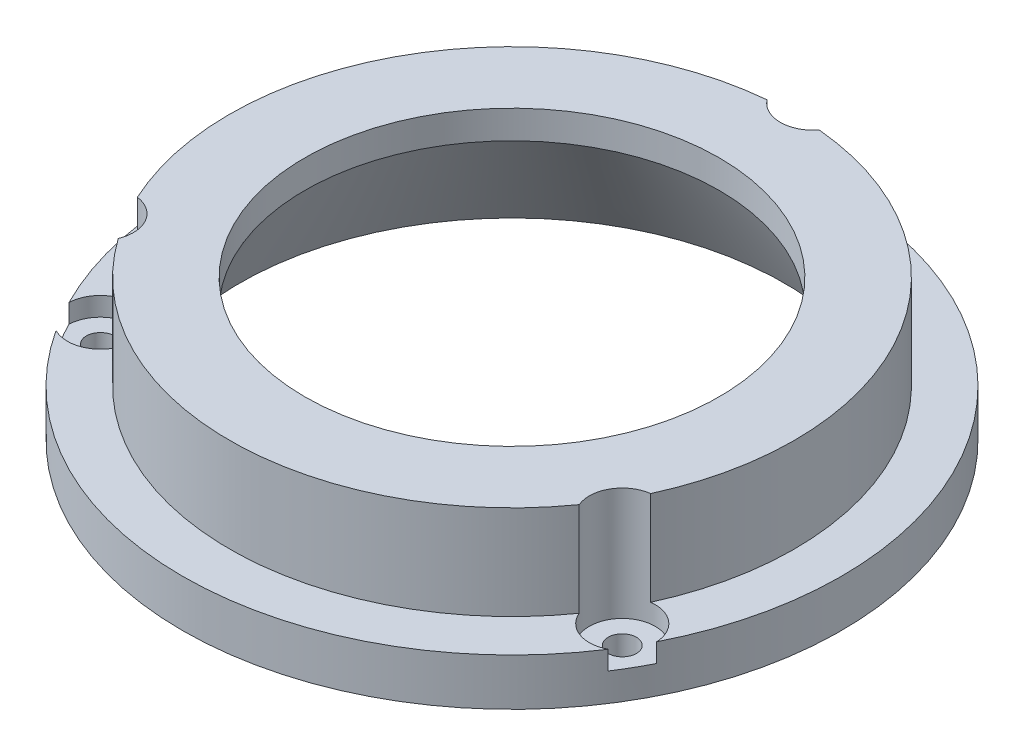
from build123d import *

# Parameters (mm, degrees)
SKETCH1_R           = 30
SKETCH1_R_2         = 22
BOSS_EXTRUDE1_DEPTH = 10
BOSS_EXTRUDE2_START = -5
SKETCH2_R           = 35
SKETCH2_R_2         = 22
BOSS_EXTRUDE2_DEPTH = 5
SKETCH3_R           = 1.5
CUT_EXTRUDE1_DEPTH  = 51.497524692
CUT_EXTRUDE2_START  = -2
SKETCH4_R           = 3.5
CUT_EXTRUDE2_DEPTH  = 53.497524692
CIRPATTERN1_COUNT   = 3
CHAMFER1_SIZE       = 12
CHAMFER1_SIZE2      = 6.92820323


with BuildPart() as part:
    # Sketch1 → Boss-Extrude1 (new body)
    with BuildSketch(Plane(origin=(0, 0, 0), x_dir=(1, 0, 0), z_dir=(0, 1, 0))):
        Circle(SKETCH1_R)
        Circle(SKETCH1_R_2, mode=Mode.SUBTRACT)
    extrude(amount=BOSS_EXTRUDE1_DEPTH)

    # Sketch2 → Boss-Extrude2 (add)
    with BuildSketch(Plane(origin=(0, 0, 0), x_dir=(1, 0, 0), z_dir=(0, 1, 0)).offset(BOSS_EXTRUDE2_START)):
        Circle(SKETCH2_R)
        Circle(SKETCH2_R_2, mode=Mode.SUBTRACT)
    extrude(amount=BOSS_EXTRUDE2_DEPTH)

    # Sketch3 → Cut-Extrude1 (cut, through all)
    with BuildSketch(Plane(origin=(0, 0, 0), x_dir=(1, 0, 0), z_dir=(0, 1, 0))):
        with Locations((0, 32)):
            Circle(SKETCH3_R)
    cut_extrude1 = extrude(amount=-CUT_EXTRUDE1_DEPTH, mode=Mode.SUBTRACT)

    # Sketch4 → Cut-Extrude2 (cut)
    with BuildSketch(Plane(origin=(0, 0, 0), x_dir=(1, 0, 0), z_dir=(0, 1, 0)).offset(CUT_EXTRUDE2_START)):
        with Locations((0, 32)):
            Circle(SKETCH4_R)
    cut_extrude2 = extrude(amount=CUT_EXTRUDE2_DEPTH, mode=Mode.SUBTRACT)

    # CirPattern1: Cut-Extrude1, Cut-Extrude2 ×3 about axis
    cirpattern1_axis = Axis((0, -5, 0), (0, 1, 0))
    add([cut_extrude1.rotate(cirpattern1_axis, i * 360 / CIRPATTERN1_COUNT) for i in range(1, CIRPATTERN1_COUNT)], mode=Mode.SUBTRACT)
    add([cut_extrude2.rotate(cirpattern1_axis, i * 360 / CIRPATTERN1_COUNT) for i in range(1, CIRPATTERN1_COUNT)], mode=Mode.SUBTRACT)

    # Chamfer1
    chamfer1_edges = [part.edges().sort_by_distance(p)[0] for p in [
        (-22, -5, 0),
    ]]
    chamfer1_side = [part.faces().sort_by_distance(p)[0] for p in [
        (-22, 2.5, 0),
    ]]
    chamfer(chamfer1_edges, length=CHAMFER1_SIZE, length2=CHAMFER1_SIZE2, reference=chamfer1_side[0])


solid = part.part
